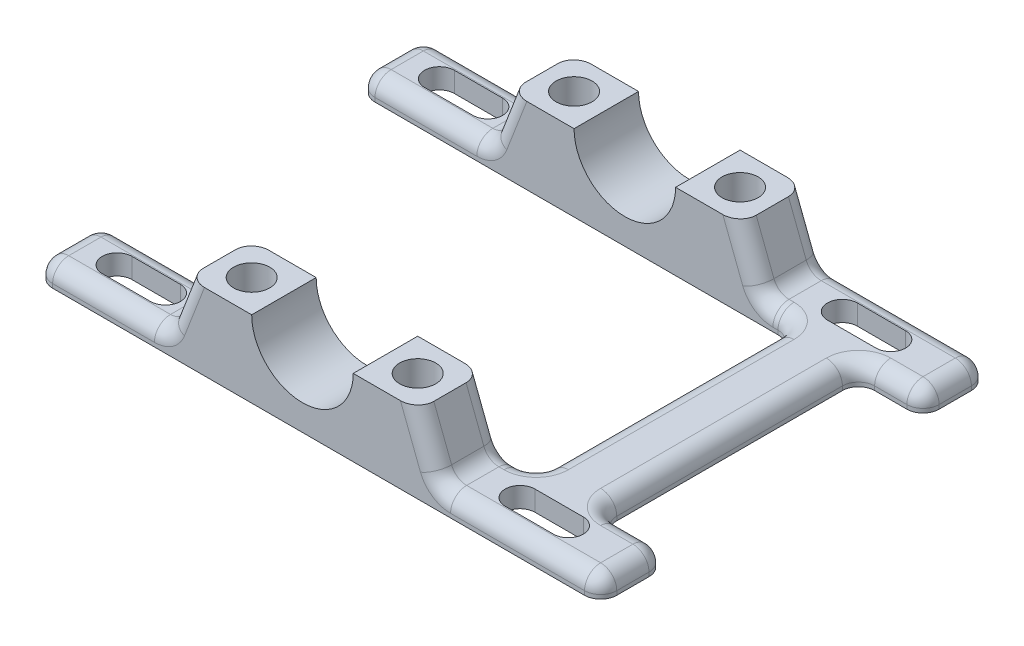
from build123d import *

# Parameters (mm, degrees)
SKETCH1_W           = 88.9
SKETCH1_H           = 30.48
BOSS_EXTRUDE1_DEPTH = 3.175
BOSS_EXTRUDE2_DEPTH = 10.16
SKETCH3_W           = 68.58
SKETCH3_H           = 20.32
SKETCH3_W_2         = 10.16
CUT_EXTRUDE1_DEPTH  = 95.751277696
SKETCH5_R           = 2.8448
CUT_EXTRUDE2_DEPTH  = 12.7
CUT_EXTRUDE3_DEPTH  = 95.399536545
FILLET1_R           = 2.54


with BuildPart() as part:
    # Sketch1 → Boss-Extrude1 (new body)
    with BuildSketch(Plane(origin=(0, 0, 0), x_dir=(1, 0, 0), z_dir=(0, 1, 0))):
        with Locations((-44.45, -15.24)):
            Rectangle(SKETCH1_W, SKETCH1_H)
    boss_extrude1 = extrude(amount=BOSS_EXTRUDE1_DEPTH)

    # Sketch2 → Boss-Extrude2 (add)
    with BuildSketch(Plane.XY.offset(30.48)):
        with BuildLine():
            Line((-68.58, 3.175), (-65.151, 12.065))
            Line((-65.151, 12.065), (-54.991, 12.065))
            ThreePointArc((-54.991, 12.065), (-46.99, 4.064), (-38.989, 12.065))
            Line((-38.989, 12.065), (-28.829, 12.065))
            Line((-28.829, 12.065), (-25.4, 3.175))
            Line((-25.4, 3.175), (-68.58, 3.175))
        make_face()
    boss_extrude2 = extrude(amount=-BOSS_EXTRUDE2_DEPTH)

    # Sketch3 → Cut-Extrude1 (cut, through all)
    with BuildSketch(Plane(origin=(0, 0, 0), x_dir=(1, 0, 0), z_dir=(0, 1, 0))):
        with Locations((-54.61, -10.16)):
            Rectangle(SKETCH3_W, SKETCH3_H)
        with Locations((-5.08, -10.16)):
            Rectangle(SKETCH3_W_2, SKETCH3_H)
    cut_extrude1 = extrude(amount=CUT_EXTRUDE1_DEPTH, mode=Mode.SUBTRACT)

    # Sketch5 → Cut-Extrude2 (cut)
    with BuildSketch(Plane(origin=(0, 12.065, 0), x_dir=(1, 0, 0), z_dir=(0, 1, 0))):
        with Locations((-33.909, -25.4)):
            Circle(SKETCH5_R)
        with Locations((-60.071, -25.4)):
            Circle(SKETCH5_R)
    cut_extrude2 = extrude(amount=-CUT_EXTRUDE2_DEPTH, mode=Mode.SUBTRACT)

    # Sketch6 → Cut-Extrude3 (cut, through all)
    with BuildSketch(Plane(origin=(0, 3.175, 0), x_dir=(1, 0, 0), z_dir=(0, 1, 0))):
        with BuildLine():
            Line((-81.28, -23.0505), (-73.66, -23.0505))
            ThreePointArc((-73.66, -23.0505), (-71.3105, -25.4), (-73.66, -27.7495))
            Line((-73.66, -27.7495), (-81.28, -27.7495))
            ThreePointArc((-81.28, -27.7495), (-83.6295, -25.4), (-81.28, -23.0505))
        make_face()
        with BuildLine():
            Line((-17.78, -23.0505), (-10.16, -23.0505))
            ThreePointArc((-10.16, -23.0505), (-7.8105, -25.4), (-10.16, -27.7495))
            Line((-10.16, -27.7495), (-17.78, -27.7495))
            ThreePointArc((-17.78, -27.7495), (-20.1295, -25.4), (-17.78, -23.0505))
        make_face()
    cut_extrude3 = extrude(amount=-CUT_EXTRUDE3_DEPTH, mode=Mode.SUBTRACT)

    # Mirror4: Boss-Extrude1, Boss-Extrude2, Cut-Extrude1, Cut-Extrude2, Cut-Extrude3 across plane
    add(boss_extrude1.mirror(Plane.XY))
    add(boss_extrude2.mirror(Plane.XY))
    add(cut_extrude1.mirror(Plane.XY), mode=Mode.SUBTRACT)
    add(cut_extrude2.mirror(Plane.XY), mode=Mode.SUBTRACT)
    add(cut_extrude3.mirror(Plane.XY), mode=Mode.SUBTRACT)

    # Fillet1
    fillet1_edges = [part.edges().sort_by_distance(p)[0] for p in [
        (-78.74, 3.175, -30.48),
        (-66.8655, 7.62, -20.32),
        (-78.74, 3.175, 20.32),
        (-78.74, 3.175, 30.48),
        (-12.7, 3.175, -30.48),
        (-27.1145, 7.62, -20.32),
        (-22.86, 3.175, 20.32),
        (-12.7, 3.175, 30.48),
        (-20.32, 1.5875, -20.32),
        (-20.32, 1.5875, 20.32),
        (0, 1.5875, -30.48),
        (0, 1.5875, 30.48),
        (-88.9, 1.5875, 20.32),
        (-88.9, 1.5875, 30.48),
        (-88.9, 1.5875, -30.48),
        (-88.9, 1.5875, -20.32),
        (-88.9, 3.175, -25.4),
        (-66.8655, 7.62, -30.48),
        (-78.74, 3.175, -20.32),
        (-88.9, 3.175, 25.4),
        (-66.8655, 7.62, 20.32),
        (-66.8655, 7.62, 30.48),
        (0, 3.175, 25.4),
        (-27.1145, 7.62, -30.48),
        (-22.86, 3.175, -20.32),
        (-20.32, 3.175, 0),
        (-27.1145, 7.62, 20.32),
        (-27.1145, 7.62, 30.48),
        (-25.4, 3.175, 25.4),
        (-25.4, 3.175, -25.4),
        (-68.58, 3.175, 25.4),
        (-68.58, 3.175, -25.4),
        (0, 1.5875, 20.32),
        (-10.16, 1.5875, 20.32),
        (-10.16, 1.5875, -20.32),
        (0, 1.5875, -20.32),
        (0, 3.175, -25.4),
        (-5.08, 3.175, -20.32),
        (-10.16, 3.175, 0),
        (-5.08, 3.175, 20.32),
    ]]
    fillet(fillet1_edges, radius=FILLET1_R)


solid = part.part
